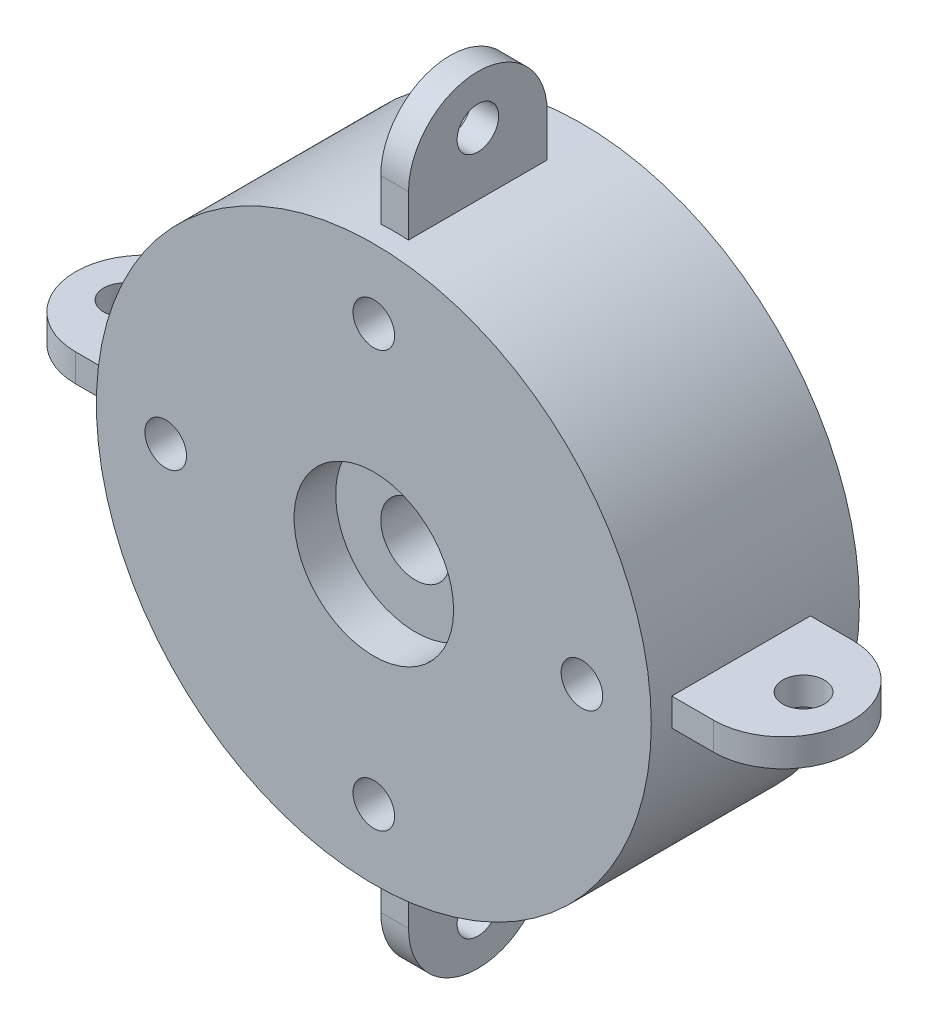
from build123d import *

# Parameters (mm, degrees)
SKETCH_1_R               = 40
EXTRUDE_1_DEPTH          = 30
SKETCH_2_R               = 3
CUT_EXTRUDE_1_DEPTH      = 65.031242374
EXTRUDE_2_DEPTH          = 2
SKETCH_4_R               = 3
CUT_EXTRUDE_2_DEPTH      = 77.157731059
PATTERN_CIRCULAR_2_COUNT = 4
CUT_EXTRUDE_3_REACH      = 86.688
SKETCH_5_R               = 5
SKETCH_6_R               = 11.5
CUT_EXTRUDE_4_DEPTH      = 6


with BuildPart() as part:
    # 草图1 → 凸台-拉伸1 (new body)
    with BuildSketch(Plane.XY):
        Circle(SKETCH_1_R)
    extrude(amount=EXTRUDE_1_DEPTH)

    # 草图2 → 切除-拉伸1 (cut, through all)
    with BuildSketch(Plane.XY.offset(30)):
        with Locations((30, 0)):
            Circle(SKETCH_2_R)
        with Locations((0, 30)):
            Circle(SKETCH_2_R)
        with Locations((-30, 0)):
            Circle(SKETCH_2_R)
        with Locations((0, -30)):
            Circle(SKETCH_2_R)
    extrude(amount=-CUT_EXTRUDE_1_DEPTH, mode=Mode.SUBTRACT)

    # 草图3 → 凸台-拉伸2 (add, symmetric)
    with BuildSketch(Plane(origin=(0, 0, 0), x_dir=(0, 0, -1), z_dir=(1, 0, 0))):
        with BuildLine():
            Line((-7, 38), (-27, 38))
            Line((-27, 38), (-27, 46))
            ThreePointArc((-27, 46), (-17, 56), (-7, 46))
            Line((-7, 46), (-7, 38))
        make_face()
    extrude_2 = extrude(amount=EXTRUDE_2_DEPTH, both=True)

    # 草图4 → 切除-拉伸2 (cut, through all)
    with BuildSketch(Plane(origin=(2, 0, 0), x_dir=(0, 0, -1), z_dir=(1, 0, 0))):
        with Locations((-17, 48.949968711)):
            Circle(SKETCH_4_R)
    cut_extrude_2 = extrude(amount=-CUT_EXTRUDE_2_DEPTH, mode=Mode.SUBTRACT)

    # 阵列(圆周)2: 凸台-拉伸2, 切除-拉伸2 ×4 about axis
    pattern_circular_2_axis = Axis((0, 0, 30), (0, 0, -1))
    add([extrude_2.rotate(pattern_circular_2_axis, i * 360 / PATTERN_CIRCULAR_2_COUNT) for i in range(1, PATTERN_CIRCULAR_2_COUNT)])
    add([cut_extrude_2.rotate(pattern_circular_2_axis, i * 360 / PATTERN_CIRCULAR_2_COUNT) for i in range(1, PATTERN_CIRCULAR_2_COUNT)], mode=Mode.SUBTRACT)

    # 草图5 → 切除-拉伸3 (cut, up to next)
    with BuildSketch(Plane(origin=(0, 0, 0), x_dir=(-1, 0, 0), z_dir=(0, 0, -1)), mode=Mode.PRIVATE) as cut_extrude_3_sk1:
        Circle(SKETCH_5_R)
    cut_extrude_3_tool1 = extrude(cut_extrude_3_sk1.sketch, amount=-CUT_EXTRUDE_3_REACH, mode=Mode.PRIVATE) & part.part
    add(cut_extrude_3_tool1.solids().sort_by_distance((0, 0, 0))[0], mode=Mode.SUBTRACT)

    # 草图6 → 切除-拉伸4 (cut)
    with BuildSketch(Plane.XY.offset(30)):
        Circle(SKETCH_6_R)
    extrude(amount=-CUT_EXTRUDE_4_DEPTH, mode=Mode.SUBTRACT)


solid = part.part
